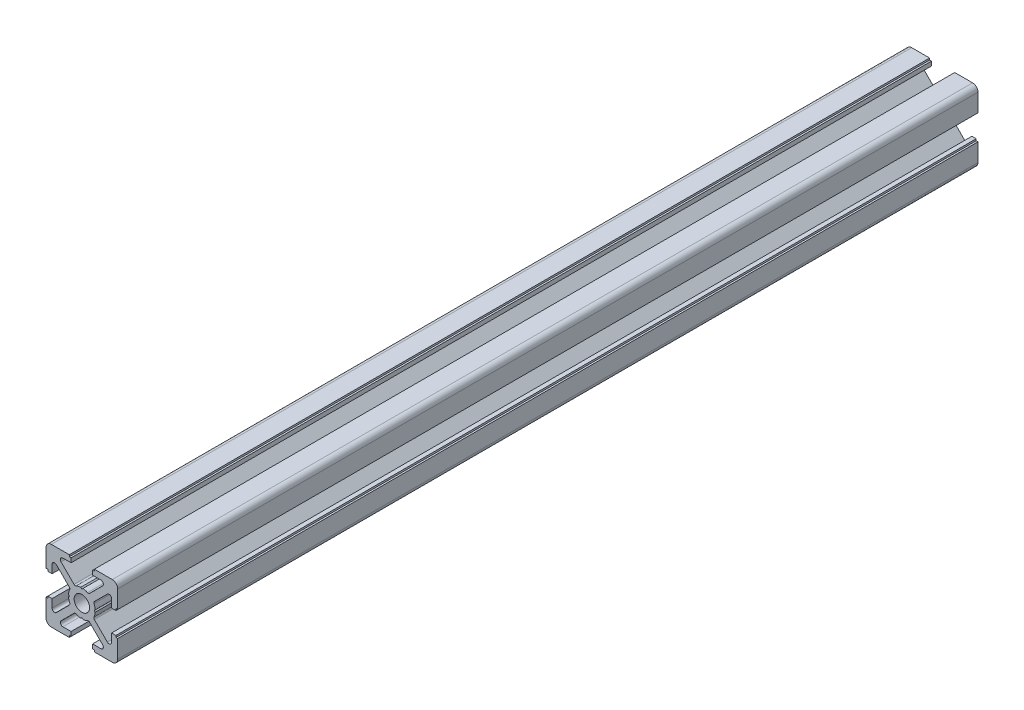
from build123d import *

# Parameters (mm, degrees)
SKETCH1_R           = 2.15
BOSS_EXTRUDE1_DEPTH = 240


with BuildPart() as part:
    # Sketch1 → Boss-Extrude1 (new body)
    with BuildSketch(Plane.XY.offset(308)):
        with BuildLine():
            Line((-3.499999948, -10), (-3.499999948, -9.5))
            Line((-3.499999948, -9.5), (-2.999999948, -9.5))
            Line((-2.999999948, -9.5), (-2.999999948, -8.299999968))
            Line((-2.999999948, -8.299999968), (-5.299390251, -8.299999968))
            ThreePointArc((-5.299390251, -8.299999968), (-5.946105923, -7.867878372), (-5.794365, -7.105025224))
            Line((-5.794365, -7.105025224), (-2.175465548, -3.48612574))
            ThreePointArc((-2.175465548, -3.48612574), (-1.907085057, -3.346986956), (-1.607569547, -3.387952169))
            ThreePointArc((-1.607569547, -3.387952169), (-0.96970891, -3.622452814), (-0.299999981, -3.73798071))
            Line((-0.299999981, -3.73798071), (1.9e-08, -3.449999972))
            Line((1.9e-08, -3.449999972), (0.300000019, -3.737980711))
            ThreePointArc((0.300000019, -3.737980711), (0.969708957, -3.622452812), (1.607569601, -3.387952162))
            ThreePointArc((1.607569601, -3.387952162), (1.90708511, -3.346986948), (2.175465602, -3.48612573))
            Line((2.175465602, -3.48612573), (5.794365085, -7.105025213))
            ThreePointArc((5.794365085, -7.105025213), (5.946106012, -7.867878368), (5.299390335, -8.299999968))
            Line((5.299390335, -8.299999968), (2.999999948, -8.299999968))
            Line((2.999999948, -8.299999968), (2.999999948, -9.5))
            Line((2.999999948, -9.5), (3.499999948, -9.5))
            Line((3.499999948, -9.5), (3.499999948, -10))
            Line((3.499999948, -10), (8.499999948, -10))
            ThreePointArc((8.499999948, -10), (9.56066012, -9.560660172), (9.999999948, -8.5))
            Line((9.999999948, -8.5), (9.999999948, -3.5))
            Line((9.999999948, -3.5), (9.499999948, -3.5))
            Line((9.499999948, -3.5), (9.499999948, -3))
            Line((9.499999948, -3), (8.299999976, -3))
            Line((8.299999976, -3), (8.299999976, -5.299390317))
            ThreePointArc((8.299999976, -5.299390317), (7.867878377, -5.94610599), (7.105025227, -5.794365061))
            Line((7.105025227, -5.794365061), (3.486125768, -2.17546557))
            ThreePointArc((3.486125768, -2.17546557), (3.346986986, -1.907085078), (3.387952202, -1.607569568))
            ThreePointArc((3.387952202, -1.607569568), (3.622452857, -0.969708918), (3.737980757, -0.299999973))
            Line((3.737980757, -0.299999973), (3.450000019, 2.8e-08))
            Line((3.450000019, 2.8e-08), (3.737980758, 0.300000028))
            ThreePointArc((3.737980758, 0.300000028), (3.622452857, 0.969708973), (3.387952202, 1.607569624))
            ThreePointArc((3.387952202, 1.607569624), (3.346986986, 1.907085133), (3.486125768, 2.175465626))
            Line((3.486125768, 2.175465626), (7.105025228, 5.794365118))
            ThreePointArc((7.105025228, 5.794365118), (7.867878378, 5.946106047), (8.299999976, 5.299390374))
            Line((8.299999976, 5.299390374), (8.299999976, 3))
            Line((8.299999976, 3), (9.499999948, 3))
            Line((9.499999948, 3), (9.499999948, 3.5))
            Line((9.499999948, 3.5), (9.999999948, 3.5))
            Line((9.999999948, 3.5), (9.999999948, 8.5))
            ThreePointArc((9.999999948, 8.5), (9.56066012, 9.560660172), (8.499999948, 10))
            Line((8.499999948, 10), (3.499999948, 10))
            Line((3.499999948, 10), (3.499999948, 9.5))
            Line((3.499999948, 9.5), (2.999999948, 9.5))
            Line((2.999999948, 9.5), (2.999999948, 8.300000024))
            Line((2.999999948, 8.300000024), (5.299390295, 8.300000024))
            ThreePointArc((5.299390295, 8.300000024), (5.946105965, 7.86787843), (5.794365042, 7.105025283))
            Line((5.794365042, 7.105025283), (2.175465586, 3.486125796))
            ThreePointArc((2.175465586, 3.486125796), (1.907085095, 3.346987012), (1.607569585, 3.387952225))
            ThreePointArc((1.607569585, 3.387952225), (0.969708948, 3.62245287), (0.300000018, 3.737980766))
            Line((0.300000018, 3.737980766), (1.9e-08, 3.450000028))
            Line((1.9e-08, 3.450000028), (-0.299999982, 3.737980766))
            ThreePointArc((-0.299999982, 3.737980766), (-0.969708911, 3.62245287), (-1.607569547, 3.387952225))
            ThreePointArc((-1.607569547, 3.387952225), (-1.907085057, 3.346987012), (-2.175465548, 3.486125796))
            Line((-2.175465548, 3.486125796), (-5.794365, 7.105025279))
            ThreePointArc((-5.794365, 7.105025279), (-5.946105923, 7.867878428), (-5.299390251, 8.300000024))
            Line((-5.299390251, 8.300000024), (-2.999999948, 8.300000024))
            Line((-2.999999948, 8.300000024), (-2.999999948, 9.5))
            Line((-2.999999948, 9.5), (-3.499999948, 9.5))
            Line((-3.499999948, 9.5), (-3.499999948, 10))
            Line((-3.499999948, 10), (-8.499999948, 10))
            ThreePointArc((-8.499999948, 10), (-9.56066012, 9.560660172), (-9.999999948, 8.5))
            Line((-9.999999948, 8.5), (-9.999999948, 3.5))
            Line((-9.999999948, 3.5), (-9.499999948, 3.5))
            Line((-9.499999948, 3.5), (-9.499999948, 3))
            Line((-9.499999948, 3), (-8.299999938, 3))
            Line((-8.299999938, 3), (-8.299999938, 5.299390329))
            ThreePointArc((-8.299999938, 5.299390329), (-7.867878344, 5.946105997), (-7.1050252, 5.794365072))
            Line((-7.1050252, 5.794365072), (-3.486125739, 2.175465611))
            ThreePointArc((-3.486125739, 2.175465611), (-3.346986957, 1.907085119), (-3.387952171, 1.607569609))
            ThreePointArc((-3.387952171, 1.607569609), (-3.622452821, 0.969708966), (-3.737980719, 0.300000029))
            Line((-3.737980719, 0.300000029), (-3.449999981, 2.8e-08))
            Line((-3.449999981, 2.8e-08), (-3.737980719, -0.299999971))
            ThreePointArc((-3.737980719, -0.299999971), (-3.622452819, -0.969708917), (-3.387952164, -1.607569568))
            ThreePointArc((-3.387952164, -1.607569568), (-3.346986948, -1.907085078), (-3.486125729, -2.17546557))
            Line((-3.486125729, -2.17546557), (-7.105025189, -5.794365061))
            ThreePointArc((-7.105025189, -5.794365061), (-7.867878339, -5.94610599), (-8.299999938, -5.299390317))
            Line((-8.299999938, -5.299390317), (-8.299999938, -3))
            Line((-8.299999938, -3), (-9.499999948, -3))
            Line((-9.499999948, -3), (-9.499999948, -3.5))
            Line((-9.499999948, -3.5), (-9.999999948, -3.5))
            Line((-9.999999948, -3.5), (-9.999999948, -8.5))
            ThreePointArc((-9.999999948, -8.5), (-9.56066012, -9.560660172), (-8.499999948, -10))
            Line((-8.499999948, -10), (-3.499999948, -10))
        make_face()
        with Locations((1.9e-08, 2.8e-08)):
            Circle(SKETCH1_R, mode=Mode.SUBTRACT)
    extrude(amount=-BOSS_EXTRUDE1_DEPTH)


solid = part.part
